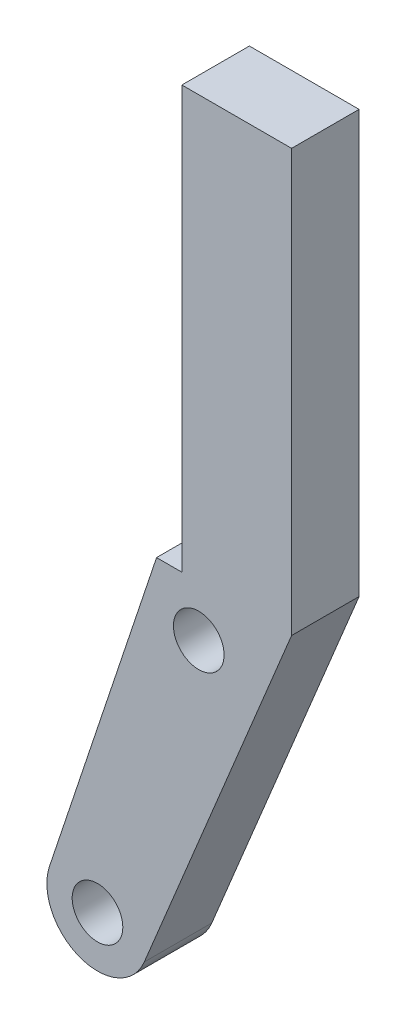
from build123d import *

# Parameters (mm, degrees)
SKETCH1_R           = 1.499999946
SKETCH1_R_2         = 1.500000009
BOSS_EXTRUDE2_DEPTH = 4


# Read off the part's stored shape, not the designer's step: Imported1
with BuildPart() as part:
    # Sketch1 → Boss-Extrude2 (new body)
    with BuildSketch(Plane.XY.offset(4.00000019)):
        with BuildLine():
            Line((8.00000038, 47.970000654), (14.499999583, 47.970000654))
            Line((14.499999583, 47.970000654), (14.499999583, 22.970002145))
            Line((14.499999583, 22.970002145), (5.772520595, 1.854081769))
            ThreePointArc((5.772520595, 1.854081769), (1.951680977, 0.189123339), (0.154201944, 3.949438629))
            Line((0.154201944, 3.949438629), (6.500000134, 22.970002145))
            Line((6.500000134, 22.970002145), (8.00000038, 22.970002145))
            Line((8.00000038, 22.970002145), (8.00000038, 47.970000654))
        make_face()
        with Locations((9.000000172, 19.969999637)):
            Circle(SKETCH1_R, mode=Mode.SUBTRACT)
        with Locations((3.000000037, 2.99999995)):
            Circle(SKETCH1_R_2, mode=Mode.SUBTRACT)
    extrude(amount=BOSS_EXTRUDE2_DEPTH)


solid = part.part
